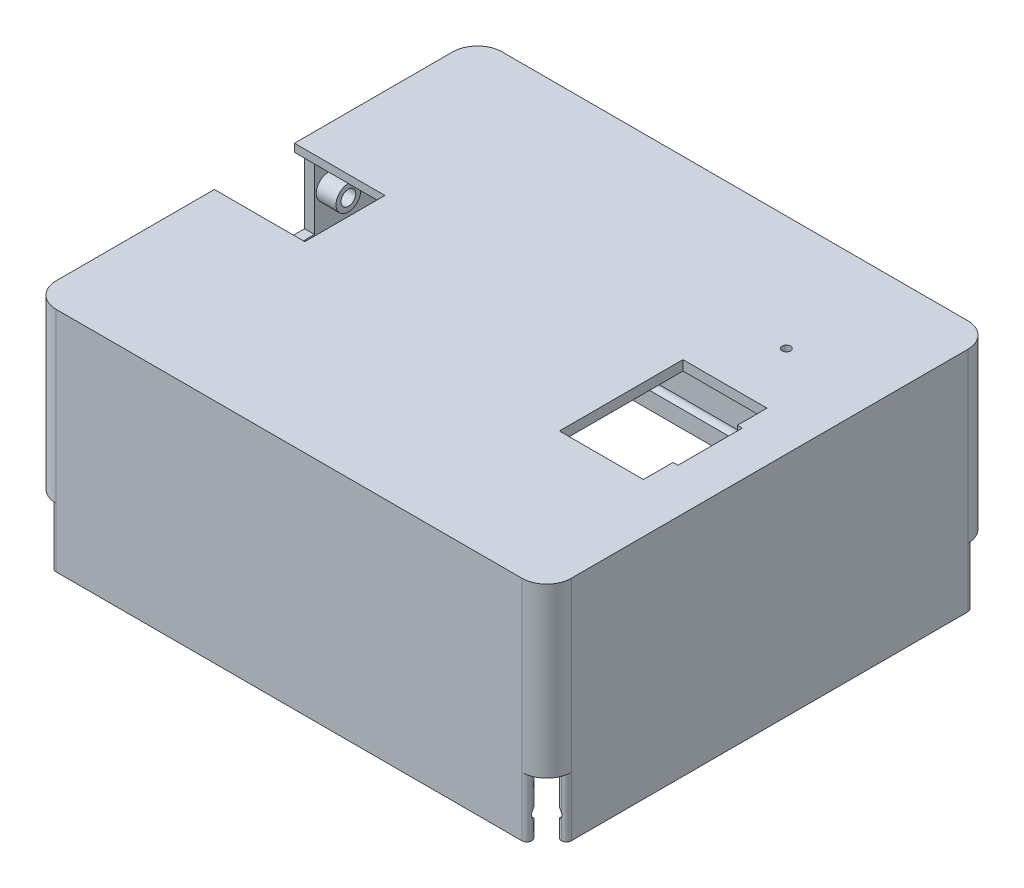
from build123d import *

# Parameters (mm, degrees)
ESQUISSE1_W                  = 104.2
ESQUISSE1_H                  = 90.2
BOSS_EXTRU_1_DEPTH           = 2
ESQUISSE2_W                  = 104.2
ESQUISSE2_H                  = 90.2
ESQUISSE2_W_2                = 100.2
ESQUISSE2_H_2                = 86.2
BOSS_EXTRU_2_DEPTH           = 44
ENL_V_MAT_EXTRU_1_DEPTH      = 12
SYM_TRIE2_COPY_1_DEPTH       = 12
CONG_3_R                     = 1
CONG_1_R                     = 5
ENL_V_MAT_EXTRU_2_DEPTH      = 82.758302331
ENL_V_MAT_EXTRU_3_DEPTH      = 82.758302438
ENL_V_MAT_EXTRU_4_DEPTH      = 122.768838535
ENL_V_MAT_EXTRU_4_DEPTH_BACK = 5
ESQUISSE6_W                  = 20.3
ESQUISSE6_H                  = 14
ESQUISSE7_W                  = 16.2
ESQUISSE7_H                  = 2
ENL_V_MAT_EXTRU_5_DEPTH      = 18.3
ESQUISSE11_W                 = 20
ESQUISSE11_H                 = 20.3
ENL_V_MAT_EXTRU_8_DEPTH      = 0.4
ESQUISSE15_W                 = 100.6
ESQUISSE15_H                 = 86.6
ENL_V_MAT_EXTRU_10_DEPTH     = 4.5
ESQUISSE16_R                 = 1.5
ENL_V_MAT_EXTRU_11_DEPTH     = 4
ENL_V_MAT_EXTRU_12_REACH     = 84.852
ESQUISSE17_W                 = 17
ESQUISSE17_H                 = 25
ESQUISSE19_R                 = 0.85
ENL_V_MAT_EXTRU_13_DEPTH     = 2
ESQUISSE20_R                 = 2.5
ESQUISSE20_R_2               = 1.5
BOSS_EXTRU_4_DEPTH           = 4
ENL_V_MAT_EXTRU_14_REACH     = 84.852
ESQUISSE21_W                 = 1
ESQUISSE21_H                 = 13
ESQUISSE22_W                 = 1.4
ESQUISSE22_H                 = 5.5
ESQUISSE22_W_2               = 24
ESQUISSE22_H_2               = 2
BOSS_EXTRU_5_DEPTH           = 2
ESQUISSE25_W                 = 5.5
ESQUISSE25_H                 = 7.5
BOSS_EXTRU_6_DEPTH           = 2


with BuildPart() as part:
    # Esquisse1 → Boss.-Extru.1 (new body)
    with BuildSketch(Plane(origin=(0, 0, 0), x_dir=(1, 0, 0), z_dir=(0, 1, 0))):
        Rectangle(ESQUISSE1_W, ESQUISSE1_H)
    extrude(amount=BOSS_EXTRU_1_DEPTH)

    # Esquisse2 → Boss.-Extru.2 (add)
    with BuildSketch(Plane.XZ):
        Rectangle(ESQUISSE2_W, ESQUISSE2_H)
        Rectangle(ESQUISSE2_W_2, ESQUISSE2_H_2, mode=Mode.SUBTRACT)
    extrude(amount=BOSS_EXTRU_2_DEPTH)

    # Esquisse3 → Enlèv. mat.-Extru.1 (cut)
    with BuildSketch(Plane.XZ.offset(44)):
        Polygon((-50.1, 41.1), (-50.1, 43.1), (-48.1, 43.1), (-48.1, 45.1), (-52.1, 45.1), (-52.1, 41.1), align=None)
    enl_v_mat_extru_1 = extrude(amount=-ENL_V_MAT_EXTRU_1_DEPTH, mode=Mode.SUBTRACT)

    # Symétrie1: Enlèv. mat.-Extru.1 across plane
    add(enl_v_mat_extru_1.mirror(Plane.XY), mode=Mode.SUBTRACT)

    # Symétrie2: Enlèv. mat.-Extru.1 across plane
    add(enl_v_mat_extru_1.mirror(Plane(origin=(0, 0, 0), x_dir=(0, 0, 1), z_dir=(1, 0, 0))), mode=Mode.SUBTRACT)

    # Symétrie2 copy 1 sketch → Symétrie2 copy 1 (cut)
    with BuildSketch(Plane(origin=(0, -44, 0), x_dir=(-1, 0, 0), z_dir=(0, -1, 0))):
        Polygon((-50.1, 41.1), (-50.1, 43.1), (-48.1, 43.1), (-48.1, 45.1), (-52.1, 45.1), (-52.1, 41.1), align=None)
    extrude(amount=-SYM_TRIE2_COPY_1_DEPTH, mode=Mode.SUBTRACT)

    # Congé3
    cong_3_edges = [part.edges().sort_by_distance(p)[0] for p in [
        (-48.1, -38, 45.1),
        (-48.1, -38, 43.1),
        (-50.1, -38, 41.1),
        (-52.1, -38, 41.1),
        (48.1, -38, 45.1),
        (48.1, -38, 43.1),
        (52.1, -38, 41.1),
        (50.1, -38, 41.1),
        (52.1, -38, -41.1),
        (50.1, -38, -41.1),
        (48.1, -38, -43.1),
        (48.1, -38, -45.1),
        (-48.1, -38, -45.1),
        (-48.1, -38, -43.1),
        (-50.1, -38, -41.1),
        (-52.1, -38, -41.1),
    ]]
    fillet(cong_3_edges, radius=CONG_3_R - 0.0001)  # a hair under: the kernel refuses the full size

    # Congé1
    cong_1_edges = [part.edges().sort_by_distance(p)[0] for p in [
        (52.1, -15, 45.1),
        (52.1, -15, -45.1),
        (-52.1, -15, -45.1),
        (-52.1, -15, 45.1),
    ]]
    fillet(cong_1_edges, radius=CONG_1_R)

    # Esquisse4 → Enlèv. mat.-Extru.2 (cut, symmetric)
    with BuildSketch(Plane(origin=(0, 0, 0), x_dir=(0, 0, -1), z_dir=(1, 0, 0))):
        with BuildLine():
            Line((-43.1, -38.4), (-43.1, -40.6))
            ThreePointArc((-43.1, -40.6), (-44.2, -39.5), (-43.1, -38.4))
        make_face()
    enl_v_mat_extru_2 = extrude(amount=ENL_V_MAT_EXTRU_2_DEPTH, both=True, mode=Mode.SUBTRACT)

    # Symétrie4: Enlèv. mat.-Extru.2 across plane
    add(enl_v_mat_extru_2.mirror(Plane.XY), mode=Mode.SUBTRACT)

    # Esquisse5 → Enlèv. mat.-Extru.3 (cut, symmetric)
    with BuildSketch(Plane.XY):
        with BuildLine():
            Line((-50.1, -38.4), (-50.1, -40.6))
            ThreePointArc((-50.1, -40.6), (-51.2, -39.5), (-50.1, -38.4))
        make_face()
    enl_v_mat_extru_3 = extrude(amount=ENL_V_MAT_EXTRU_3_DEPTH, both=True, mode=Mode.SUBTRACT)

    # Symétrie5: Enlèv. mat.-Extru.3 across plane
    add(enl_v_mat_extru_3.mirror(Plane(origin=(0, 0, 0), x_dir=(0, 0, 1), z_dir=(1, 0, 0))), mode=Mode.SUBTRACT)

    # Esquisse6 → Enlèv. mat.-Extru.4 (cut, two sides: drawn at the far end of the back side and taken through both)
    with BuildSketch(Plane.ZY.offset(52.1).offset(-ENL_V_MAT_EXTRU_4_DEPTH_BACK)):
        with Locations((0, -7)):
            Rectangle(ESQUISSE6_W, ESQUISSE6_H)
    extrude(amount=ENL_V_MAT_EXTRU_4_DEPTH + ENL_V_MAT_EXTRU_4_DEPTH_BACK, mode=Mode.SUBTRACT)

    # Esquisse7 → Enlèv. mat.-Extru.5 (cut)
    with BuildSketch(Plane.ZY.offset(52.1)):
        with Locations((0, 1)):
            Rectangle(ESQUISSE7_W, ESQUISSE7_H)
    extrude(amount=-ENL_V_MAT_EXTRU_5_DEPTH, mode=Mode.SUBTRACT)

    # Esquisse11 → Enlèv. mat.-Extru.8 (cut)
    with BuildSketch(Plane(origin=(0, 0, 0), x_dir=(1, 0, 0), z_dir=(0, 1, 0))):
        with Locations((-42.1, 0)):
            Rectangle(ESQUISSE11_W, ESQUISSE11_H)
    extrude(amount=ENL_V_MAT_EXTRU_8_DEPTH, mode=Mode.SUBTRACT)

    # Esquisse15 → Enlèv. mat.-Extru.10 (cut)
    with BuildSketch(Plane.XZ.offset(44)):
        Rectangle(ESQUISSE15_W, ESQUISSE15_H)
    extrude(amount=-ENL_V_MAT_EXTRU_10_DEPTH, mode=Mode.SUBTRACT)

    # Esquisse16 → Enlèv. mat.-Extru.11 (cut)
    with BuildSketch(Plane.ZY.offset(52.1)):
        with Locations((-13, -7)):
            Circle(ESQUISSE16_R)
    enl_v_mat_extru_11 = extrude(amount=-ENL_V_MAT_EXTRU_11_DEPTH, mode=Mode.SUBTRACT)

    # Symétrie6: Enlèv. mat.-Extru.11 across plane
    add(enl_v_mat_extru_11.mirror(Plane.XY), mode=Mode.SUBTRACT)

    # Esquisse17 → Enlèv. mat.-Extru.12 (cut, up to next)
    with BuildSketch(Plane(origin=(0, 2, 0), x_dir=(1, 0, 0), z_dir=(0, 1, 0)), mode=Mode.PRIVATE) as enl_v_mat_extru_12_sk1:
        with Locations((33.6, -3.017922014)):
            Rectangle(ESQUISSE17_W, ESQUISSE17_H)
    enl_v_mat_extru_12_tool1 = extrude(enl_v_mat_extru_12_sk1.sketch, amount=-ENL_V_MAT_EXTRU_12_REACH, mode=Mode.PRIVATE) & part.part
    add(enl_v_mat_extru_12_tool1.solids().sort_by_distance((33.6, 2, 3.017922))[0], mode=Mode.SUBTRACT)

    # Esquisse19 → Enlèv. mat.-Extru.13 (cut)
    with BuildSketch(Plane.XZ):
        with Locations(Location((33.6, -21.882077986, 0), (0, 0, 270))):
            Circle(ESQUISSE19_R)
    extrude(amount=-ENL_V_MAT_EXTRU_13_DEPTH, mode=Mode.SUBTRACT)

    # Esquisse20 → Boss.-Extru.4 (add)
    # profile 1 of 2: a face of its own
    with BuildSketch(Plane(origin=(-50.1, 0, 0), x_dir=(0, 0, -1), z_dir=(1, 0, 0))):
        with Locations((-13, -7)):
            Circle(ESQUISSE20_R)
        with Locations((-13, -7)):
            Circle(ESQUISSE20_R_2, mode=Mode.SUBTRACT)
    # profile 2 of 2: a face of its own
    with BuildSketch(Plane(origin=(-50.1, 0, 0), x_dir=(0, 0, -1), z_dir=(1, 0, 0))):
        with Locations((13, -7)):
            Circle(ESQUISSE20_R)
        with Locations(Location((13, -7, 0), (0, 0, 180))):
            Circle(ESQUISSE20_R_2, mode=Mode.SUBTRACT)
    extrude(amount=BOSS_EXTRU_4_DEPTH)

    # Esquisse21 → Enlèv. mat.-Extru.14 (cut, up to next)
    with BuildSketch(Plane(origin=(0, 2, 0), x_dir=(1, 0, 0), z_dir=(0, 1, 0)), mode=Mode.PRIVATE) as enl_v_mat_extru_14_sk1:
        with Locations((42.6, -3.017922014)):
            Rectangle(ESQUISSE21_W, ESQUISSE21_H)
    enl_v_mat_extru_14_tool1 = extrude(enl_v_mat_extru_14_sk1.sketch, amount=-ENL_V_MAT_EXTRU_14_REACH, mode=Mode.PRIVATE) & part.part
    add(enl_v_mat_extru_14_tool1.solids().sort_by_distance((42.6, 2, 3.017922))[0], mode=Mode.SUBTRACT)

    # Esquisse22 → Boss.-Extru.5 (add)
    with BuildSketch(Plane.XZ):
        with Locations((22.3, 16.267922014)):
            Rectangle(ESQUISSE22_W, ESQUISSE22_H)
        with Locations((33.6, 20.017922014)):
            Rectangle(ESQUISSE22_W_2, ESQUISSE22_H_2)
        with Locations((44.9, 16.267922014)):
            Rectangle(ESQUISSE22_W, ESQUISSE22_H)
    extrude(amount=BOSS_EXTRU_5_DEPTH)

    # Esquisse25 → Boss.-Extru.6 (add)
    with BuildSketch(Plane.XZ.offset(2)):
        with Locations((24.35, 17.267922014)):
            Rectangle(ESQUISSE25_W, ESQUISSE25_H)
        with Locations((42.85, 17.267922014)):
            Rectangle(ESQUISSE25_W, ESQUISSE25_H)
    extrude(amount=BOSS_EXTRU_6_DEPTH)


solid = part.part
